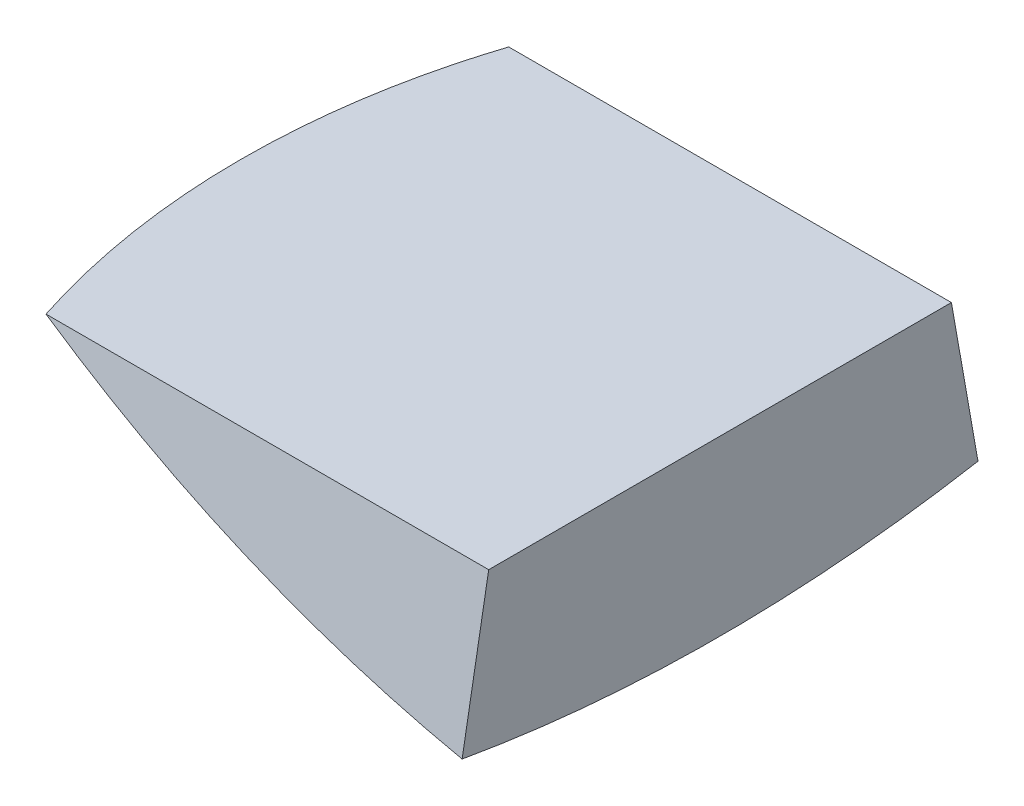
from build123d import *

# Parameters (mm, degrees)
REVOLVE1_ANGLE     = 20
SKETCH2_W          = 414.694447971
SKETCH2_H          = 155.943368172
CUT_EXTRUDE1_DEPTH = 808.512987581


with BuildPart() as part:
    # Sketch1 → Revolve1 (revolve, symmetric)
    with BuildSketch(Plane.XY) as revolve1_sk:
        with BuildLine():
            Line((-132.319911382, -750.423507795), (-132.319911382, -648.823507795))
            Line((-132.319911382, -648.823507795), (-399.589859396, -648.823507795))
            ThreePointArc((-399.589859396, -648.823507795), (-270.763071822, -712.271969782), (-132.319911382, -750.423507795))
        make_face()
    revolve(axis=Axis((0, 11.576492205, 0), (-1, 0, 0)), revolution_arc=REVOLVE1_ANGLE / 2)
    revolve(revolve1_sk.sketch, axis=Axis((0, 11.576492205, 0), (1, 0, 0)), revolution_arc=REVOLVE1_ANGLE / 2)

    # Sketch2 → Cut-Extrude1 (cut, through all)
    with BuildSketch(Plane(origin=(-132.319911382, 0, 0), x_dir=(0, 0, -1), z_dir=(1, 0, 0))):
        with Locations((-9.950026192, -583.551823709)):
            Rectangle(SKETCH2_W, SKETCH2_H)
    extrude(amount=-CUT_EXTRUDE1_DEPTH, mode=Mode.SUBTRACT)


solid = part.part
